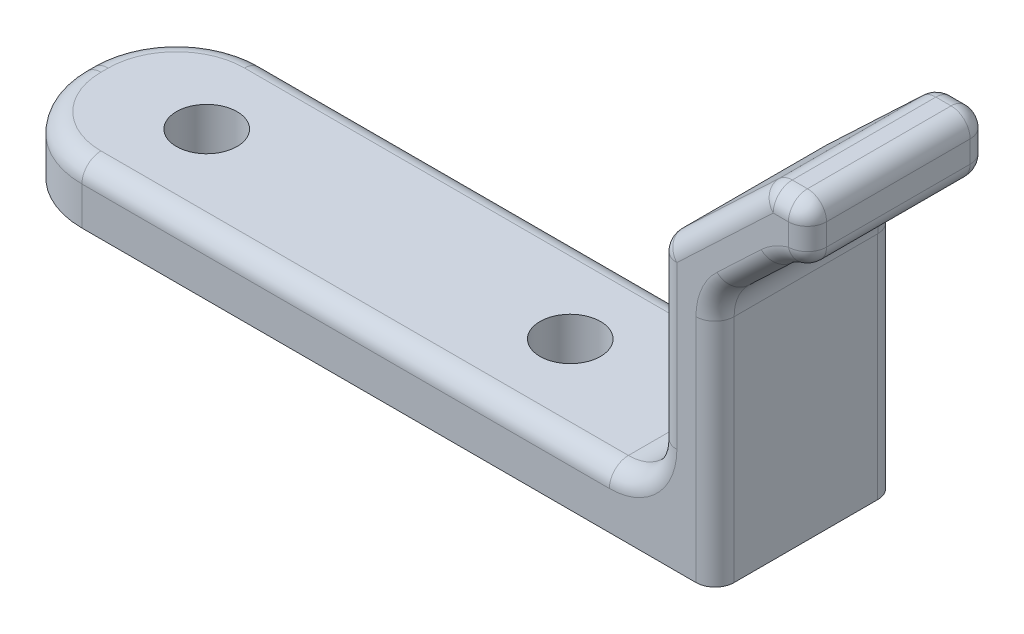
from build123d import *

# Parameters (mm, degrees)
SKETCH1_W           = 31.75
SKETCH1_H           = 9.525
BOSS_EXTRUDE1_DEPTH = 3
SKETCH2_R           = 1.5875
CUT_EXTRUDE1_DEPTH  = 17.843308204
FILLET1_R           = 4.572
SKETCH3_W           = 9.525
SKETCH3_H           = 3
BOSS_EXTRUDE2_DEPTH = 6
BOSS_EXTRUDE3_DEPTH = 9.525
FILLET3_R           = 2.54
FILLET4_R           = 1
FILLET5_R           = 2.54
FILLET7_R           = 1


with BuildPart() as part:
    # Sketch1 → Boss-Extrude1 (new body)
    with BuildSketch(Plane(origin=(0, 0, 0), x_dir=(1, 0, 0), z_dir=(0, 1, 0))):
        Rectangle(SKETCH1_W, SKETCH1_H)
    extrude(amount=BOSS_EXTRUDE1_DEPTH)

    # Sketch2 → Cut-Extrude1 (cut, through all)
    with BuildSketch(Plane(origin=(0, 3, 0), x_dir=(1, 0, 0), z_dir=(0, 1, 0))):
        with Locations(Location((-9.525, 0, 0), (0, 0, 270))):
            Circle(SKETCH2_R)
        with Locations(Location((9.525, 0, 0), (0, 0, 270))):
            Circle(SKETCH2_R)
    extrude(amount=-CUT_EXTRUDE1_DEPTH, mode=Mode.SUBTRACT)

    # Fillet1
    fillet1_edges = [part.edges().sort_by_distance(p)[0] for p in [
        (-15.875, 1.5, 4.7625),
        (-15.875, 1.5, -4.7625),
    ]]
    fillet(fillet1_edges, radius=FILLET1_R)

    # Sketch3 → Boss-Extrude2 (add)
    with BuildSketch(Plane(origin=(15.875, 0, 0), x_dir=(0, 0, -1), z_dir=(1, 0, 0))):
        with Locations((0, 1.5)):
            Rectangle(SKETCH3_W, SKETCH3_H)
    extrude(amount=BOSS_EXTRUDE2_DEPTH)

    # Sketch5 → Boss-Extrude3 (add)
    with BuildSketch(Plane.XY.offset(4.7625)):
        Polygon((18.875, 3), (18.875, 14.451976797), (24.524350343, 19.794466274), (26.718222037, 19.794466274), (26.718222037, 16.794466274), (25.718222037, 16.794466274), (21.875, 13.16), (21.875, 3), align=None)
    extrude(amount=-BOSS_EXTRUDE3_DEPTH)

    # Fillet3
    # the kernel refuses this fillet: 2.54 mm, written as the material it adds along each edge
    with BuildSketch(Plane(origin=(21.875, 13.16, 4.7625), x_dir=(0, -1, 0), z_dir=(0, 0, -1))) as fillet3_piece_1:
        with BuildLine():
            CenterArc((FILLET3_R * 0.430658932297, -FILLET3_R), FILLET3_R, 90, 46.599119654)
            Line((-FILLET3_R * 0.295905181539, -FILLET3_R * 0.312901325509), (0, 0))
            Line((0, 0), (FILLET3_R * 0.430658932297, 0))
        make_face()
    extrude(amount=9.525)
    with BuildSketch(Plane(origin=(25.718222037, 16.794466274, 4.7625), x_dir=(-0.7265641138352414, -0.6870986744906513, 0), z_dir=(0, 0, -1))) as fillet3_piece_2_section:
        with BuildLine():
            CenterArc((FILLET3_R * 0.39795723135, -FILLET3_R), FILLET3_R, 90, 43.400880346)
            Line((-FILLET3_R * 0.28914144314, -FILLET3_R * 0.273435886165), (0, 0))
            Line((0, 0), (FILLET3_R * 0.39795723135, 0))
        make_face()
    fillet3_piece_2 = extrude(amount=9.525, mode=Mode.PRIVATE)
    fillet3_piece_2 = split(fillet3_piece_2, bisect_by=Plane(origin=(26.718222037, 16.648240502, 0), z_dir=(-1, 0, 0)), keep=Keep.TOP, mode=Mode.PRIVATE)
    add(fillet3_piece_2)

    # Fillet4
    fillet4_edges = [part.edges().sort_by_distance(p)[0] for p in [
        (18.875, 14.451976797, 0),
        (24.524350343, 19.794466274, 0),
        (26.718222037, 19.794466274, 0),
        (26.718222037, 16.794443265, 0),
    ]]
    fillet(fillet4_edges, radius=FILLET4_R)

    # Fillet5
    fillet5_edges = [part.edges().sort_by_distance(p)[0] for p in [
        (18.875, 3, 0),
    ]]
    fillet(fillet5_edges, radius=FILLET5_R)

    # Fillet7
    fillet7_edges = [part.edges().sort_by_distance(p)[0] for p in [
        (18.875, 9.780658932, -4.7625),
        (2.516, 3, -4.7625),
        (18.131051224, 3.743948776, 4.7625),
        (18.131051224, 3.743948776, -4.7625),
        (2.516, 3, 4.7625),
        (-15.875, 3, 0),
        (-14.535892204, 3, -3.423392204),
        (-14.535892204, 3, 3.423392204),
        (21.875, 6.033063156, -4.7625),
        (21.875, 6.033063156, 4.7625),
        (23.826786069, 15.005769142, -4.7625),
        (23.826786069, 15.005769142, 4.7625),
        (22.082138473, 13.070793966, 4.7625),
        (22.082138473, 13.070793966, -4.7625),
        (25.459186859, 16.454259389, 4.7625),
        (21.711555113, 17.134456183, -4.7625),
        (21.711555113, 17.134456183, 4.7625),
        (26.718222037, 18.220775531, 4.7625),
        (25.320264806, 19.794466274, 4.7625),
        (18.875, 9.780658932, 4.7625),
        (26.519951397, 17.049397551, 4.7625),
        (26.425328818, 19.501573055, 4.7625),
        (24.552553679, 19.723596005, 4.7625),
        (18.95655058, 14.416856311, 4.7625),
        (25.320264806, 19.794466274, -4.7625),
        (26.718222037, 18.220775531, -4.7625),
        (25.459186859, 16.454259389, -4.7625),
        (26.519951397, 17.049397551, -4.7625),
        (26.425328818, 19.501573055, -4.7625),
        (24.552553679, 19.723596005, -4.7625),
        (18.95655058, 14.416856311, -4.7625),
    ]]
    fillet(fillet7_edges, radius=FILLET7_R)


solid = part.part
